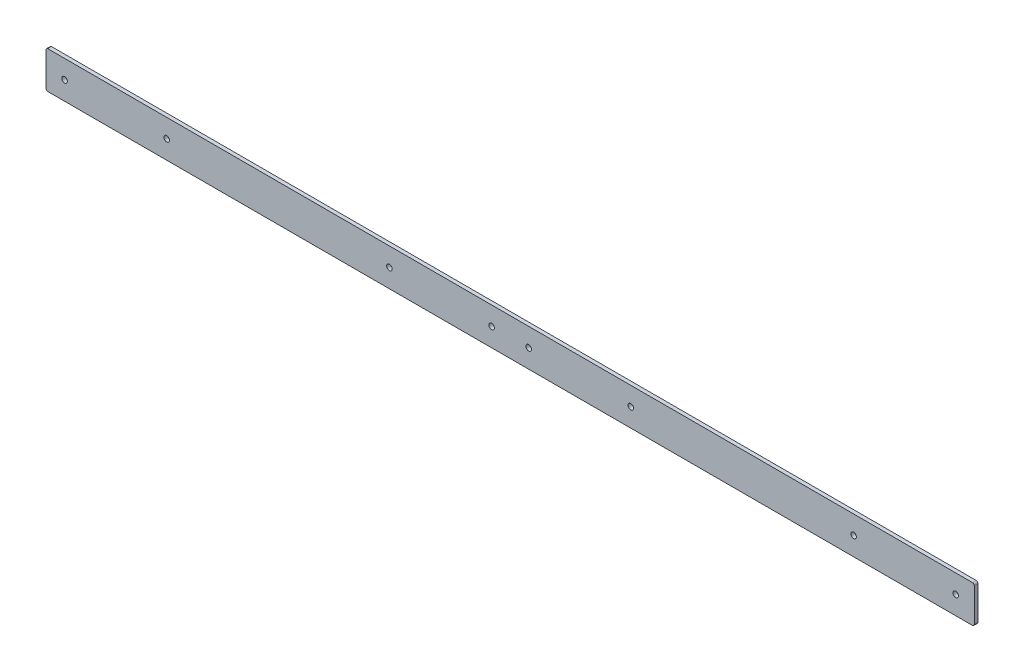
from build123d import *

# Parameters (mm, degrees)
SKETCH_1_W      = 500
SKETCH_1_H      = 20
SKETCH_1_R      = 1.5
EXTRUDE_1_DEPTH = 2
FILLET_1_R      = 1


with BuildPart() as part:
    # 草图1 → 凸台-拉伸1 (new body)
    with BuildSketch(Plane.XY):
        Rectangle(SKETCH_1_W, SKETCH_1_H)
        with Locations((240, 0)):
            Circle(SKETCH_1_R, mode=Mode.SUBTRACT)
        with Locations((185, 0)):
            Circle(SKETCH_1_R, mode=Mode.SUBTRACT)
        with Locations((-240, 0)):
            Circle(SKETCH_1_R, mode=Mode.SUBTRACT)
        with Locations((-185, 0)):
            Circle(SKETCH_1_R, mode=Mode.SUBTRACT)
        with Locations((-10, 0)):
            Circle(SKETCH_1_R, mode=Mode.SUBTRACT)
        with Locations((-65, 0)):
            Circle(SKETCH_1_R, mode=Mode.SUBTRACT)
        with Locations((10, 0)):
            Circle(SKETCH_1_R, mode=Mode.SUBTRACT)
        with Locations((65, 0)):
            Circle(SKETCH_1_R, mode=Mode.SUBTRACT)
    extrude(amount=EXTRUDE_1_DEPTH)

    # 圆角1
    fillet_1_edges = [part.edges().sort_by_distance(p)[0] for p in [
        (250, -10, 1),
        (250, 10, 1),
        (-250, -10, 1),
        (-250, 10, 1),
    ]]
    fillet(fillet_1_edges, radius=FILLET_1_R)


solid = part.part
